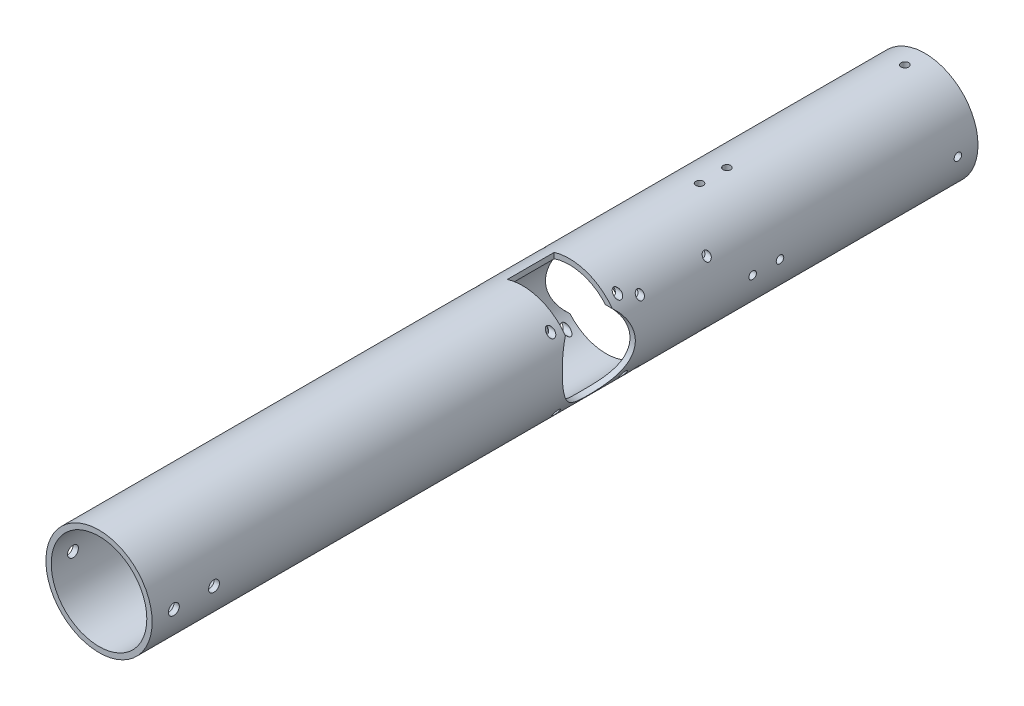
from build123d import *

# Parameters (mm, degrees)
BOSS_EXTRUDE1_DEPTH           = 125
BOSS_EXTRUDE1_DEPTH_BACK      = 250
SKETCH1_R                     = 31.75
SKETCH1_R_2                   = 28.575
SKETCH2_R                     = 21.75
CUT_EXTRUDE1_DEPTH            = 255.000246063
SKETCH3_R                     = 21.75
CUT_EXTRUDE2_DEPTH            = 255.000246187
CUT_EXTRUDE4_START            = 9
SKETCH5_W                     = 28
SKETCH5_H                     = 22
CUT_EXTRUDE4_DEPTH            = 264.000246187
CUT_EXTRUDE5_START            = -9
SKETCH6_W                     = 28
SKETCH6_H                     = 22
CUT_EXTRUDE5_DEPTH            = 264.000246187
CUT_EXTRUDE8_DEPTH            = 255.000246187
CUT_EXTRUDE8_DEPTH_BACK       = 255.000246187
SKETCH11_R                    = 2
CUT_EXTRUDE10_DEPTH           = 255.000246187
CUT_EXTRUDE10_DEPTH_BACK      = 255.000246187
SKETCH12_R                    = 3.25
SKETCH13_R                    = 2.25
CUT_EXTRUDE11_DEPTH           = 255.000246187
CUT_EXTRUDE12_DEPTH           = 255.000246187
CUT_EXTRUDE12_DEPTH_BACK      = 255.000246187
SKETCH15_R                    = 2
SKETCH19_W                    = 2.25
SKETCH19_H                    = 31.75
M4_CLEARANCE_HOLE1_AT_2_COUNT = 2
M4_CLEARANCE_HOLE1_AT_2_PITCH = 40
M4_CLEARANCE_HOLE1_AT_3_COUNT = 2
M4_CLEARANCE_HOLE1_AT_3_PITCH = 40
M4_CLEARANCE_HOLE1_AT_4_COUNT = 2
M4_CLEARANCE_HOLE1_AT_4_PITCH = 56.568542495
M4_CLEARANCE_HOLE1_AT_5_COUNT = 2
M4_CLEARANCE_HOLE1_AT_5_PITCH = 90.126807577
M4_CLEARANCE_HOLE1_AT_6_COUNT = 2
M4_CLEARANCE_HOLE1_AT_6_PITCH = 50.197623888
M4_CLEARANCE_HOLE1_AT_7_COUNT = 2
M4_CLEARANCE_HOLE1_AT_7_PITCH = 100.213978286
M4_CLEARANCE_HOLE1_AT_8_COUNT = 2
M4_CLEARANCE_HOLE1_AT_8_PITCH = 66.631835064
MIRROR1_COPY_1_SKETCH_W       = 2.25
MIRROR1_COPY_1_SKETCH_H       = 31.75
MIRROR1_COPY_2_SKETCH_W       = 2.25
MIRROR1_COPY_2_SKETCH_H       = 31.75
MIRROR1_COPY_3_SKETCH_W       = 2.25
MIRROR1_COPY_3_SKETCH_H       = 31.75
MIRROR1_COPY_4_SKETCH_W       = 2.25
MIRROR1_COPY_4_SKETCH_H       = 31.75
MIRROR1_COPY_5_SKETCH_W       = 2.25
MIRROR1_COPY_5_SKETCH_H       = 31.75
MIRROR1_COPY_6_SKETCH_W       = 2.25
MIRROR1_COPY_6_SKETCH_H       = 31.75
MIRROR1_COPY_7_SKETCH_W       = 2.25
MIRROR1_COPY_7_SKETCH_H       = 31.75
SKETCH21_R                    = 30
CUT_EXTRUDE14_DEPTH           = 7
CIRPATTERN1_COUNT             = 2
CIRPATTERN1_ANGLE             = 90
SKETCH22_R                    = 2.25
CUT_EXTRUDE15_DEPTH           = 255.000246187
CIRPATTERN2_COUNT             = 4
SKETCH23_R                    = 30
SKETCH23_R_2                  = 28.575
BOSS_EXTRUDE2_DEPTH           = 7
SKETCH24_R                    = 31.75
SKETCH24_R_2                  = 28.575
BOSS_EXTRUDE3_DEPTH           = 118.65


with BuildPart() as part:
    # Sketch1 → Boss-Extrude1 (new, two sides: drawn at the far end of the back side and taken through both)
    with BuildSketch(Plane.XY.offset(-BOSS_EXTRUDE1_DEPTH_BACK)):
        Circle(SKETCH1_R)
        Circle(SKETCH1_R_2, mode=Mode.SUBTRACT)
    extrude(amount=BOSS_EXTRUDE1_DEPTH + BOSS_EXTRUDE1_DEPTH_BACK)

    # Sketch2 → Cut-Extrude1 (cut, through all)
    with BuildSketch(Plane(origin=(0, 0, 0), x_dir=(0, 0, -1), z_dir=(1, 0, 0))):
        with Locations((73.488, -2)):
            Circle(SKETCH2_R)
    extrude(amount=-CUT_EXTRUDE1_DEPTH, mode=Mode.SUBTRACT)

    # Sketch3 → Cut-Extrude2 (cut, through all)
    with BuildSketch(Plane(origin=(0, 0, 0), x_dir=(0, 0, -1), z_dir=(1, 0, 0))):
        with Locations(Location((23.45, 2, 0), (0, 0, 354.723969399))):
            Circle(SKETCH3_R)
    extrude(amount=CUT_EXTRUDE2_DEPTH, mode=Mode.SUBTRACT)

    # Sketch5 → Cut-Extrude4 (cut, through all)
    with BuildSketch(Plane(origin=(0, 0, 0), x_dir=(0, 0, -1), z_dir=(1, 0, 0)).offset(CUT_EXTRUDE4_START)):
        with Locations((73.488, -23.75)):
            Rectangle(SKETCH5_W, SKETCH5_H)
    extrude(amount=-CUT_EXTRUDE4_DEPTH, mode=Mode.SUBTRACT)

    # Sketch6 → Cut-Extrude5 (cut, through all)
    with BuildSketch(Plane(origin=(0, 0, 0), x_dir=(0, 0, -1), z_dir=(1, 0, 0)).offset(CUT_EXTRUDE5_START)):
        with Locations((23.45, 23.75)):
            Rectangle(SKETCH6_W, SKETCH6_H)
    extrude(amount=CUT_EXTRUDE5_DEPTH, mode=Mode.SUBTRACT)

    # Sketch11 → Cut-Extrude8 (cut, two sides: drawn at the far end of the back side and taken through both)
    with BuildSketch(Plane(origin=(0, 0, 0), x_dir=(0, 0, -1), z_dir=(1, 0, 0)).offset(-CUT_EXTRUDE8_DEPTH_BACK)):
        with Locations((93.488, 18)):
            Circle(SKETCH11_R)
        with Locations((53.488, 18)):
            Circle(SKETCH11_R)
        with Locations((53.488, -22)):
            Circle(SKETCH11_R)
        with Locations((93.488, -22)):
            Circle(SKETCH11_R)
    extrude(amount=CUT_EXTRUDE8_DEPTH + CUT_EXTRUDE8_DEPTH_BACK, mode=Mode.SUBTRACT)

    # Sketch12 → Cut-Extrude10 (cut, two sides: drawn at the far end of the back side and taken through both)
    with BuildSketch(Plane(origin=(0, 0, 0), x_dir=(0, 0, -1), z_dir=(1, 0, 0)).offset(-CUT_EXTRUDE10_DEPTH_BACK)):
        with Locations((-112, 0)):
            Circle(SKETCH12_R)
        with Locations((-88, 0)):
            Circle(SKETCH12_R)
    extrude(amount=CUT_EXTRUDE10_DEPTH + CUT_EXTRUDE10_DEPTH_BACK, mode=Mode.SUBTRACT)

    # Sketch13 → Cut-Extrude11 (cut, symmetric)
    with BuildSketch(Plane(origin=(0, 0, 0), x_dir=(1, 0, 0), z_dir=(0, 1, 0))):
        with Locations(Location((0, 238, 0), (0, 0, 270))):
            Circle(SKETCH13_R)
    cut_extrude11 = extrude(amount=CUT_EXTRUDE11_DEPTH, both=True, mode=Mode.SUBTRACT)

    # Sketch15 → Cut-Extrude12 (cut, two sides: drawn at the far end of the back side and taken through both)
    with BuildSketch(Plane(origin=(0, 0, 0), x_dir=(0, 0, -1), z_dir=(1, 0, 0)).offset(-CUT_EXTRUDE12_DEPTH_BACK)):
        with Locations((3.45, 22)):
            Circle(SKETCH15_R)
        with Locations((43.45, 22)):
            Circle(SKETCH15_R)
        with Locations((43.45, -18)):
            Circle(SKETCH15_R)
        with Locations((3.45, -18)):
            Circle(SKETCH15_R)
    extrude(amount=CUT_EXTRUDE12_DEPTH + CUT_EXTRUDE12_DEPTH_BACK, mode=Mode.SUBTRACT)

    # Sketch19 → M4 Clearance Hole1 (revolve, cut)
    with BuildSketch(Plane(origin=(0, 22, -3.45), x_dir=(0, 0, 1), z_dir=(0, 1, 0))):
        with Locations((1.125, 15.875)):
            Rectangle(SKETCH19_W, SKETCH19_H)
    m4_clearance_hole1 = revolve(axis=Axis((-6.35, 22, -3.45), (1, 0, 0)), mode=Mode.SUBTRACT)

    # M4 Clearance Hole1 at 2: M4 Clearance Hole1 ×2
    with Locations(*[(0, 0, -i * M4_CLEARANCE_HOLE1_AT_2_PITCH) for i in range(1, M4_CLEARANCE_HOLE1_AT_2_COUNT)]):
        add(m4_clearance_hole1, mode=Mode.SUBTRACT)

    # M4 Clearance Hole1 at 3: M4 Clearance Hole1 ×2
    with Locations(*[(0, -i * M4_CLEARANCE_HOLE1_AT_3_PITCH, 0) for i in range(1, M4_CLEARANCE_HOLE1_AT_3_COUNT)]):
        add(m4_clearance_hole1, mode=Mode.SUBTRACT)

    # M4 Clearance Hole1 at 4: M4 Clearance Hole1 ×2
    with Locations(*[Vector(0, -0.7071067811865478, -0.7071067811865472) * (i * M4_CLEARANCE_HOLE1_AT_4_PITCH) for i in range(1, M4_CLEARANCE_HOLE1_AT_4_COUNT)]):
        add(m4_clearance_hole1, mode=Mode.SUBTRACT)

    # M4 Clearance Hole1 at 5: M4 Clearance Hole1 ×2
    with Locations(*[Vector(0, -0.04438191152602306, -0.9990146374950151) * (i * M4_CLEARANCE_HOLE1_AT_5_PITCH) for i in range(1, M4_CLEARANCE_HOLE1_AT_5_COUNT)]):
        add(m4_clearance_hole1, mode=Mode.SUBTRACT)

    # M4 Clearance Hole1 at 6: M4 Clearance Hole1 ×2
    with Locations(*[Vector(0, -0.07968504662542611, -0.9968200907607669) * (i * M4_CLEARANCE_HOLE1_AT_6_PITCH) for i in range(1, M4_CLEARANCE_HOLE1_AT_6_COUNT)]):
        add(m4_clearance_hole1, mode=Mode.SUBTRACT)

    # M4 Clearance Hole1 at 7: M4 Clearance Hole1 ×2
    with Locations(*[Vector(0, -0.43906050585303297, -0.8984574960453493) * (i * M4_CLEARANCE_HOLE1_AT_7_PITCH) for i in range(1, M4_CLEARANCE_HOLE1_AT_7_COUNT)]):
        add(m4_clearance_hole1, mode=Mode.SUBTRACT)

    # M4 Clearance Hole1 at 8: M4 Clearance Hole1 ×2
    with Locations(*[Vector(0, -0.6603450131265124, -0.7509623583369185) * (i * M4_CLEARANCE_HOLE1_AT_8_PITCH) for i in range(1, M4_CLEARANCE_HOLE1_AT_8_COUNT)]):
        add(m4_clearance_hole1, mode=Mode.SUBTRACT)

    # Mirror1: M4 Clearance Hole1 across plane
    add(m4_clearance_hole1.mirror(Plane(origin=(0, 0, 0), x_dir=(0, 0, 1), z_dir=(1, 0, 0))), mode=Mode.SUBTRACT)

    # Mirror1 copy 1 sketch → Mirror1 copy 1 (revolve, cut)
    with BuildSketch(Plane(origin=(0, 22, -43.45), x_dir=(0, 0, 1), z_dir=(0, 1, 0))):
        with Locations((1.125, -15.875)):
            Rectangle(MIRROR1_COPY_1_SKETCH_W, MIRROR1_COPY_1_SKETCH_H)
    revolve(axis=Axis((6.35, 22, -43.45), (1, 0, 0)), mode=Mode.SUBTRACT)

    # Mirror1 copy 2 sketch → Mirror1 copy 2 (revolve, cut)
    with BuildSketch(Plane(origin=(0, -18, -3.45), x_dir=(0, 0, 1), z_dir=(0, 1, 0))):
        with Locations((1.125, -15.875)):
            Rectangle(MIRROR1_COPY_2_SKETCH_W, MIRROR1_COPY_2_SKETCH_H)
    revolve(axis=Axis((6.35, -18, -3.45), (1, 0, 0)), mode=Mode.SUBTRACT)

    # Mirror1 copy 3 sketch → Mirror1 copy 3 (revolve, cut)
    with BuildSketch(Plane(origin=(0, -18, -43.45), x_dir=(0, 0, 1), z_dir=(0, 1, 0))):
        with Locations((1.125, -15.875)):
            Rectangle(MIRROR1_COPY_3_SKETCH_W, MIRROR1_COPY_3_SKETCH_H)
    revolve(axis=Axis((6.35, -18, -43.45), (1, 0, 0)), mode=Mode.SUBTRACT)

    # Mirror1 copy 4 sketch → Mirror1 copy 4 (revolve, cut)
    with BuildSketch(Plane(origin=(0, 18, -93.488), x_dir=(0, 0, 1), z_dir=(0, 1, 0))):
        with Locations((1.125, -15.875)):
            Rectangle(MIRROR1_COPY_4_SKETCH_W, MIRROR1_COPY_4_SKETCH_H)
    revolve(axis=Axis((6.35, 18, -93.488), (1, 0, 0)), mode=Mode.SUBTRACT)

    # Mirror1 copy 5 sketch → Mirror1 copy 5 (revolve, cut)
    with BuildSketch(Plane(origin=(0, 18, -53.488), x_dir=(0, 0, 1), z_dir=(0, 1, 0))):
        with Locations((1.125, -15.875)):
            Rectangle(MIRROR1_COPY_5_SKETCH_W, MIRROR1_COPY_5_SKETCH_H)
    revolve(axis=Axis((6.35, 18, -53.488), (1, 0, 0)), mode=Mode.SUBTRACT)

    # Mirror1 copy 6 sketch → Mirror1 copy 6 (revolve, cut)
    with BuildSketch(Plane(origin=(0, -22, -93.488), x_dir=(0, 0, 1), z_dir=(0, 1, 0))):
        with Locations((1.125, -15.875)):
            Rectangle(MIRROR1_COPY_6_SKETCH_W, MIRROR1_COPY_6_SKETCH_H)
    revolve(axis=Axis((6.35, -22, -93.488), (1, 0, 0)), mode=Mode.SUBTRACT)

    # Mirror1 copy 7 sketch → Mirror1 copy 7 (revolve, cut)
    with BuildSketch(Plane(origin=(0, -22, -53.488), x_dir=(0, 0, 1), z_dir=(0, 1, 0))):
        with Locations((1.125, -15.875)):
            Rectangle(MIRROR1_COPY_7_SKETCH_W, MIRROR1_COPY_7_SKETCH_H)
    revolve(axis=Axis((6.35, -22, -53.488), (1, 0, 0)), mode=Mode.SUBTRACT)

    # Sketch21 → Cut-Extrude14 (cut)
    with BuildSketch(Plane(origin=(0, 0, -250), x_dir=(-1, 0, 0), z_dir=(0, 0, -1))):
        Circle(SKETCH21_R)
    extrude(amount=-CUT_EXTRUDE14_DEPTH, mode=Mode.SUBTRACT)

    # CirPattern1: Cut-Extrude11 ×2 about axis
    cirpattern1_axis = Axis((0, 0, -250), (0, 0, 1))
    for i in range(1, CIRPATTERN1_COUNT):
        add(cut_extrude11.rotate(cirpattern1_axis, i * CIRPATTERN1_ANGLE / (CIRPATTERN1_COUNT - 1)), mode=Mode.SUBTRACT)

    # Sketch22 → Cut-Extrude15 (cut, through all)
    with BuildSketch(Plane(origin=(0, 0, 0), x_dir=(0, 0, -1), z_dir=(1, 0, 0))):
        with Locations(Location((131.65, 0, 0), (0, 0, 180))):
            Circle(SKETCH22_R)
        with Locations(Location((115.3, 0, 0), (0, 0, 180))):
            Circle(SKETCH22_R)
    cut_extrude15 = extrude(amount=CUT_EXTRUDE15_DEPTH, mode=Mode.SUBTRACT)

    # CirPattern2: Cut-Extrude15 ×4 about axis
    cirpattern2_axis = Axis((0, 0, -250), (0, 0, 1))
    for i in range(1, CIRPATTERN2_COUNT):
        add(cut_extrude15.rotate(cirpattern2_axis, i * 360 / CIRPATTERN2_COUNT), mode=Mode.SUBTRACT)

    # Sketch23 → Boss-Extrude2 (add)
    with BuildSketch(Plane(origin=(0, 0, -243), x_dir=(-1, 0, 0), z_dir=(0, 0, -1))):
        Circle(SKETCH23_R)
        with Locations(Location((0, 0, 0), (0, 0, 180))):
            Circle(SKETCH23_R_2, mode=Mode.SUBTRACT)
    extrude(amount=BOSS_EXTRUDE2_DEPTH)


with BuildPart() as body_2:
    # Split1: the piece on the far side of the plane
    add(part.part)
    split(bisect_by=Plane.XY.offset(75), keep=Keep.BOTTOM)


with BuildPart() as part_1:
    add(part.part)

    # Split1
    split(bisect_by=Plane.XY.offset(75), keep=Keep.TOP)


with BuildPart() as part_2:
    # Body-Move/Copy1: moved
    add(part_1.part.moved(Location((0, 0, 118.65))))


    add(body_2.part)  # Boss-Extrude3 merges body 2
    # Sketch24 → Boss-Extrude3 (add)
    with BuildSketch(Plane.XY.offset(75)):
        Circle(SKETCH24_R)
        Circle(SKETCH24_R_2, mode=Mode.SUBTRACT)
    extrude(amount=BOSS_EXTRUDE3_DEPTH)


solid = part_2.part
